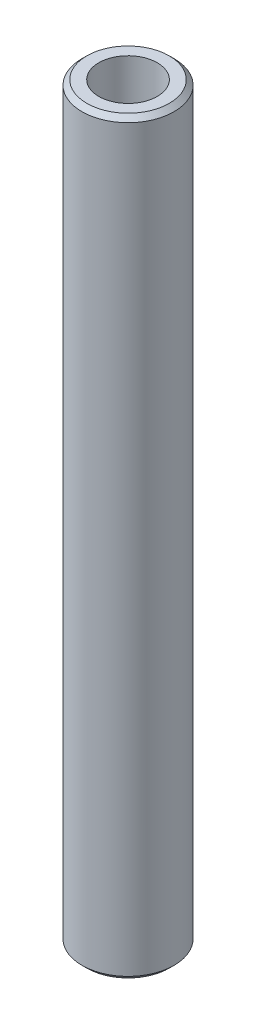
from build123d import *

# Parameters (mm, degrees)
SKETCH1_R           = 25
BOSS_EXTRUDE1_DEPTH = 406.783600367
SKETCH2_R           = 15.885593689
CUT_EXTRUDE1_DEPTH  = 409.317153114
CHAMFER1_SIZE       = 2.616203345


with BuildPart() as part:
    # Sketch1 → Boss-Extrude1 (new body)
    with BuildSketch(Plane(origin=(0, 0, 0), x_dir=(1, 0, 0), z_dir=(0, 1, 0))):
        Circle(SKETCH1_R)
    extrude(amount=BOSS_EXTRUDE1_DEPTH)

    # Sketch2 → Cut-Extrude1 (cut, through all)
    with BuildSketch(Plane(origin=(0, 0, 0), x_dir=(1, 0, 0), z_dir=(0, 1, 0))):
        Circle(SKETCH2_R)
    extrude(amount=CUT_EXTRUDE1_DEPTH, mode=Mode.SUBTRACT)

    # Chamfer1
    chamfer1_edges = [part.edges().sort_by_distance(p)[0] for p in [
        (-25, 406.783600367, 0),
        (-25, 0, 0),
    ]]
    chamfer(chamfer1_edges, length=CHAMFER1_SIZE)


solid = part.part
